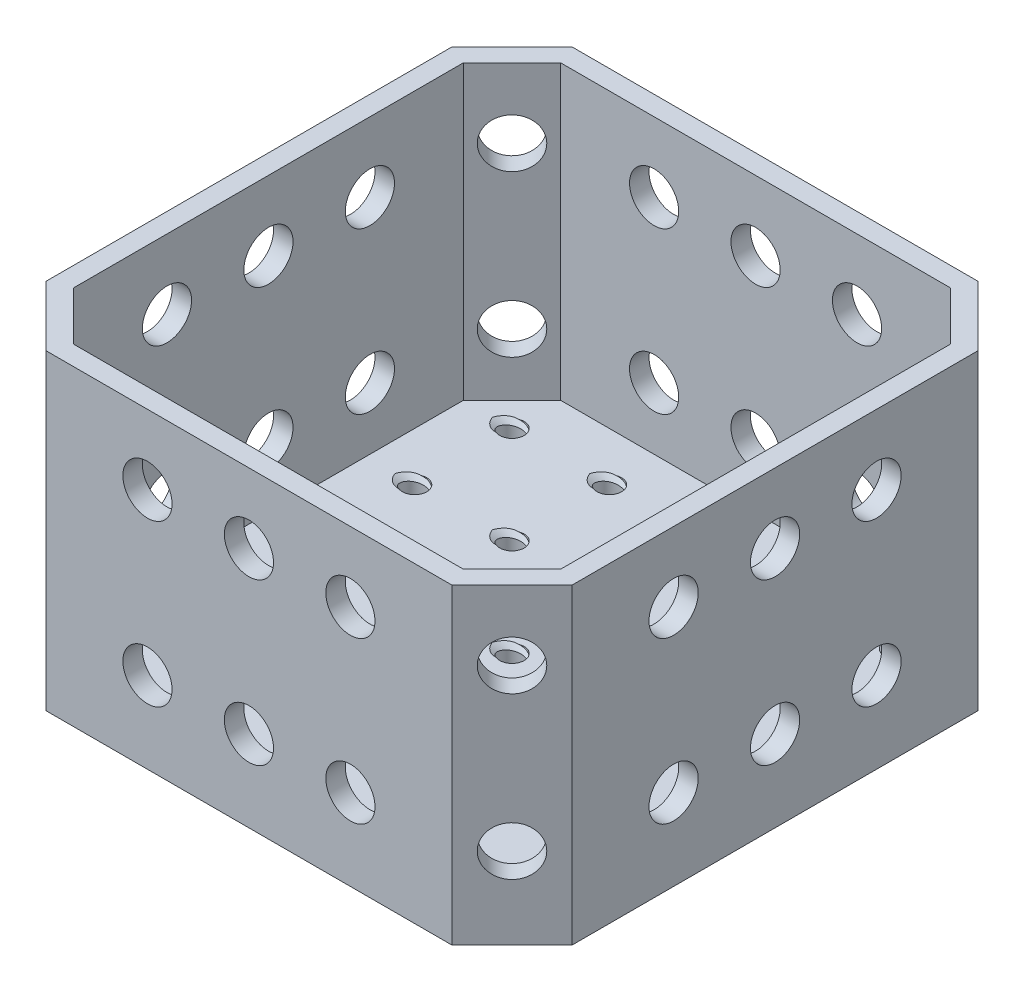
from build123d import *

# Parameters (mm, degrees)
BOSS_EXTRUDE1_DEPTH  = 60
BOSS_EXTRUDE2_DEPTH  = 4
SKETCH3_R            = 2.5
CUT_EXTRUDE1_DEPTH   = 26
CUT_SWEEP1_PITCH     = 4
LPATTERN2_COUNT      = 5
LPATTERN2_PITCH      = 20
LPATTERN2_COUNT_DIR2 = 5
LPATTERN2_PITCH_DIR2 = 20
SKETCH6_R            = 5.05
CUT_EXTRUDE2_DEPTH   = 184
SKETCH7_R            = 5.05
CUT_EXTRUDE3_DEPTH   = 184
SKETCH8_R            = 5.05
CUT_EXTRUDE4_DEPTH   = 184
SKETCH9_R            = 5.05
CUT_EXTRUDE5_DEPTH   = 184


with BuildPart() as part:
    # Sketch1 → Boss-Extrude1 (new body)
    with BuildSketch(Plane(origin=(0, 0, 0), x_dir=(1, 0, 0), z_dir=(0, 1, 0))):
        Polygon((8.343145751, 104), (91.656854249, 104), (104, 91.656854249), (104, 8.343145751), (91.656854249, -4), (8.343145751, -4), (-4, 8.343145751), (-4, 91.656854249), align=None)
        Polygon((0, 90), (10, 100), (90, 100), (100, 90), (100, 10), (90, 0), (10, 0), (0, 10), align=None, mode=Mode.SUBTRACT)
    extrude(amount=BOSS_EXTRUDE1_DEPTH)

    # Sketch2 → Boss-Extrude2 (add)
    with BuildSketch(Plane.XZ):
        Polygon((-4, -91.656854249), (-4, -8.343145751), (8.343145751, 4), (91.656854249, 4), (104, -8.343145751), (104, -91.656854249), (91.656854249, -104), (8.343145751, -104), align=None)
    extrude(amount=BOSS_EXTRUDE2_DEPTH)

    # Sketch3 → Cut-Extrude1 (cut)
    with BuildSketch(Plane(origin=(0, 0, 0), x_dir=(1, 0, 0), z_dir=(0, 1, 0))):
        with Locations(Location((10, 90, 0), (0, 0, 270))):
            Circle(SKETCH3_R)
        with Locations(Location((30, 90, 0), (0, 0, 270))):
            Circle(SKETCH3_R)
        with Locations(Location((50, 90, 0), (0, 0, 270))):
            Circle(SKETCH3_R)
        with Locations(Location((70, 90, 0), (0, 0, 270))):
            Circle(SKETCH3_R)
        with Locations(Location((90, 90, 0), (0, 0, 270))):
            Circle(SKETCH3_R)
        with Locations(Location((10, 70, 0), (0, 0, 270))):
            Circle(SKETCH3_R)
        with Locations(Location((30, 70, 0), (0, 0, 270))):
            Circle(SKETCH3_R)
        with Locations(Location((50, 70, 0), (0, 0, 270))):
            Circle(SKETCH3_R)
        with Locations(Location((70, 70, 0), (0, 0, 270))):
            Circle(SKETCH3_R)
        with Locations(Location((90, 70, 0), (0, 0, 270))):
            Circle(SKETCH3_R)
        with Locations(Location((10, 50, 0), (0, 0, 270))):
            Circle(SKETCH3_R)
        with Locations(Location((30, 50, 0), (0, 0, 270))):
            Circle(SKETCH3_R)
        with Locations(Location((50, 50, 0), (0, 0, 270))):
            Circle(SKETCH3_R)
        with Locations(Location((70, 50, 0), (0, 0, 270))):
            Circle(SKETCH3_R)
        with Locations(Location((90, 50, 0), (0, 0, 270))):
            Circle(SKETCH3_R)
        with Locations(Location((10, 30, 0), (0, 0, 270))):
            Circle(SKETCH3_R)
        with Locations(Location((30, 30, 0), (0, 0, 270))):
            Circle(SKETCH3_R)
        with Locations(Location((50, 30, 0), (0, 0, 270))):
            Circle(SKETCH3_R)
        with Locations(Location((70, 30, 0), (0, 0, 270))):
            Circle(SKETCH3_R)
        with Locations(Location((90, 30, 0), (0, 0, 270))):
            Circle(SKETCH3_R)
        with Locations(Location((10, 10, 0), (0, 0, 270))):
            Circle(SKETCH3_R)
        with Locations(Location((30, 10, 0), (0, 0, 270))):
            Circle(SKETCH3_R)
        with Locations(Location((50, 10, 0), (0, 0, 270))):
            Circle(SKETCH3_R)
        with Locations(Location((70, 10, 0), (0, 0, 270))):
            Circle(SKETCH3_R)
        with Locations(Location((90, 10, 0), (0, 0, 270))):
            Circle(SKETCH3_R)
    extrude(amount=-CUT_EXTRUDE1_DEPTH, mode=Mode.SUBTRACT)

    # Cut-Sweep1: arcs per turn and ends read off the stored shape
    # Cut-Sweep1: the profile of Sketch5 screwed along a right-hand helix through 2.5 turns, 12 arcs to a turn; built about Z, then put on its axis
    cut_sweep1_z = Axis((0, 0, 0), (0, 0, 1))
    cut_sweep1_corners = [(2.5, 0, -4), (2.5, 0, -4.75), (4, 0, -4), (2.5, 0, -3.25)]
    with BuildLine(mode=Mode.PRIVATE) as cut_sweep1_profile:
        Line(cut_sweep1_corners[0], cut_sweep1_corners[1])
        Line(cut_sweep1_corners[1], cut_sweep1_corners[2])
        Line(cut_sweep1_corners[2], cut_sweep1_corners[3])
        Line(cut_sweep1_corners[3], cut_sweep1_corners[0])
    cut_sweep1_cap = Face(cut_sweep1_profile.wire())
    cut_sweep1_turn_angles = [0, 15, 30, 45, 60, 75, 90, 105, 120, 135, 150, 165, 180, 195, 210, 225, 240, 255, 270, 285, 300, 315, 330, 345, 360]
    cut_sweep1_turn_weights = [1, 0.9659258262890683, 1, 0.9659258262890683, 1, 0.9659258262890683, 1, 0.9659258262890683, 1, 0.9659258262890683, 1, 0.9659258262890683, 1, 0.9659258262890683, 1, 0.9659258262890683, 1, 0.9659258262890683, 1, 0.9659258262890683, 1, 0.9659258262890683, 1, 0.9659258262890683, 1]
    cut_sweep1_turn_rails = [Edge.make_bspline([Vector(p[0], p[1], 0).rotate(cut_sweep1_z, cut_sweep1_turn_angles[k]) / cut_sweep1_turn_weights[k] + Vector(0, 0, p[2] + CUT_SWEEP1_PITCH * cut_sweep1_turn_angles[k] / 360) for k in range(25)], [0, 0, 0, 1, 1, 2, 2, 3, 3, 4, 4, 5, 5, 6, 6, 7, 7, 8, 8, 9, 9, 10, 10, 11, 11, 12, 12, 12], 2, cut_sweep1_turn_weights) for p in cut_sweep1_corners]
    cut_sweep1_turn_sides = [Face.make_surface_from_curves(cut_sweep1_turn_rails[p[0]], cut_sweep1_turn_rails[p[1]]) for p in [(0, 1), (1, 2), (2, 3), (3, 0)]]
    cut_sweep1_last_angles = [720, 735, 750, 765, 780, 795, 810, 825, 840, 855, 870, 885, 900]
    cut_sweep1_last_weights = [1, 0.9659258262890683, 1, 0.9659258262890683, 1, 0.9659258262890683, 1, 0.9659258262890683, 1, 0.9659258262890683, 1, 0.9659258262890683, 1]
    cut_sweep1_last_rails = [Edge.make_bspline([Vector(p[0], p[1], 0).rotate(cut_sweep1_z, cut_sweep1_last_angles[k]) / cut_sweep1_last_weights[k] + Vector(0, 0, p[2] + CUT_SWEEP1_PITCH * cut_sweep1_last_angles[k] / 360) for k in range(13)], [0, 0, 0, 1, 1, 2, 2, 3, 3, 4, 4, 5, 5, 6, 6, 6], 2, cut_sweep1_last_weights) for p in cut_sweep1_corners]
    cut_sweep1_last_sides = [Face.make_surface_from_curves(cut_sweep1_last_rails[p[0]], cut_sweep1_last_rails[p[1]]) for p in [(0, 1), (1, 2), (2, 3), (3, 0)]]
    cut_sweep1 = Plane(origin=(10, 0, -90), x_dir=(-1, 0, 0), z_dir=(0, -1, 0)) * Solid(Shell([*[p.moved(Location((0, 0, CUT_SWEEP1_PITCH * i))) for i in range(2) for p in cut_sweep1_turn_sides], *cut_sweep1_last_sides, cut_sweep1_cap, cut_sweep1_cap.rotate(cut_sweep1_z, 900).moved(Location((0, 0, CUT_SWEEP1_PITCH * 900 / 360)))]))
    add(cut_sweep1, mode=Mode.SUBTRACT)

    # LPattern2: Cut-Sweep1 5 × 5
    with Locations(*[(i * LPATTERN2_PITCH, 0, j * LPATTERN2_PITCH_DIR2) for i in range(LPATTERN2_COUNT) for j in range(LPATTERN2_COUNT_DIR2) if (i, j) != (0, 0)]):
        add(cut_sweep1, mode=Mode.SUBTRACT)

    # Sketch6 → Cut-Extrude2 (cut)
    with BuildSketch(Plane(origin=(2.171572875, 0, -2.171572875), x_dir=(0.7071067811865475, 0, 0.7071067811865476), z_dir=(-0.7071067811865476, 0, 0.7071067811865475))):
        with Locations((0, 12.7)):
            Circle(SKETCH6_R)
        with Locations((0, 45.7)):
            Circle(SKETCH6_R)
    extrude(amount=-CUT_EXTRUDE2_DEPTH, mode=Mode.SUBTRACT)

    # Sketch7 → Cut-Extrude3 (cut)
    with BuildSketch(Plane(origin=(47.828427125, 0, 47.828427125), x_dir=(0.7071067811865475, 0, -0.7071067811865477), z_dir=(0.7071067811865477, 0, 0.7071067811865475))):
        with Locations((70.710678119, 12.7)):
            Circle(SKETCH7_R)
        with Locations((70.710678119, 45.7)):
            Circle(SKETCH7_R)
    extrude(amount=-CUT_EXTRUDE3_DEPTH, mode=Mode.SUBTRACT)

    # Sketch8 → Cut-Extrude4 (cut)
    with BuildSketch(Plane.ZY.offset(4)):
        with Locations((-50, 45.7)):
            Circle(SKETCH8_R)
        with Locations((-50, 12.7)):
            Circle(SKETCH8_R)
        with Locations((-70.828427125, 45.7)):
            Circle(SKETCH8_R)
        with Locations((-70.828427125, 12.7)):
            Circle(SKETCH8_R)
        with Locations((-29.171572875, 12.7)):
            Circle(SKETCH8_R)
        with Locations((-29.171572875, 45.7)):
            Circle(SKETCH8_R)
    extrude(amount=-CUT_EXTRUDE4_DEPTH, mode=Mode.SUBTRACT)

    # Sketch9 → Cut-Extrude5 (cut)
    with BuildSketch(Plane(origin=(0, 0, -104), x_dir=(-1, 0, 0), z_dir=(0, 0, -1))):
        with Locations((-50, 45.7)):
            Circle(SKETCH9_R)
        with Locations((-70.828427125, 45.7)):
            Circle(SKETCH9_R)
        with Locations((-50, 12.7)):
            Circle(SKETCH9_R)
        with Locations((-70.828427125, 12.7)):
            Circle(SKETCH9_R)
        with Locations((-29.171572875, 12.7)):
            Circle(SKETCH9_R)
        with Locations((-29.171572875, 45.7)):
            Circle(SKETCH9_R)
    extrude(amount=-CUT_EXTRUDE5_DEPTH, mode=Mode.SUBTRACT)


solid = part.part
